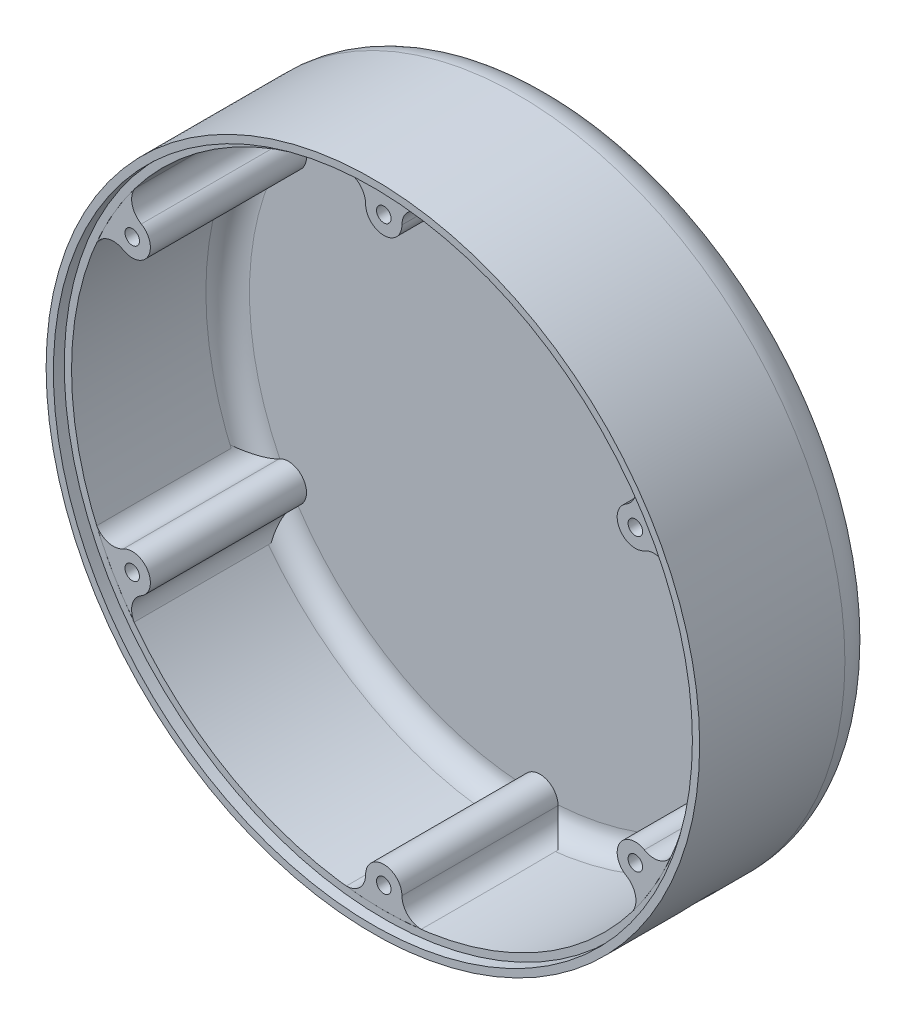
from build123d import *

# Parameters (mm, degrees)
SKETCH1_R           = 90
BOSS_EXTRUDE1_DEPTH = 50
FILLET1_R           = 10
SHELL1_T            = -4
BOSS_EXTRUDE2_START = -46
BOSS_EXTRUDE2_DEPTH = 46
SKETCH3_R           = 2
CUT_EXTRUDE1_DEPTH  = 20
CIRPATTERN1_COUNT   = 6
SKETCH5_R           = 88
CUT_EXTRUDE2_DEPTH  = 3
SKETCH6_R           = 5
CUT_EXTRUDE3_DEPTH  = 137.747943312


# Read off the part's stored shape, not the designer's step: Boss-Extrude2
with BuildPart() as part:
    # Sketch1 → Boss-Extrude1 (new body)
    with BuildSketch(Plane.XY):
        Circle(SKETCH1_R)
    extrude(amount=BOSS_EXTRUDE1_DEPTH)

    # Fillet1
    fillet1_edges = [part.edges().sort_by_distance(p)[0] for p in [
        (-90, 0, 0),
    ]]
    fillet(fillet1_edges, radius=FILLET1_R)

    # Shell1
    shell1_openings = [part.faces().sort_by_distance(p)[0] for p in [
        (0, 0, 50),
    ]]
    offset(amount=SHELL1_T, openings=shell1_openings, kind=Kind.INTERSECTION)

    # Boss-Extrude2 outline → Boss-Extrude2 (add)
    with BuildSketch(Plane.XY.offset(50).offset(BOSS_EXTRUDE2_START)):
        with BuildLine():
            ThreePointArc((-10.335164835, 85.335164835), (-6.562633601, 83.772531234), (-5, 80))
            ThreePointArc((-5, 80), (0, 75), (5, 80))
            ThreePointArc((5, 80), (6.804282934, 83.999607083), (10.996761978, 85.293984609))
            ThreePointArc((10.996761978, 85.293984609), (0.332080343, 85.978550607), (-10.335164835, 85.335164835))
        make_face()
    boss_extrude2 = extrude(amount=BOSS_EXTRUDE2_DEPTH)

    # Sketch3 → Cut-Extrude1 (cut)
    with BuildSketch(Plane.XY.offset(50)):
        with Locations((0, 80)):
            Circle(SKETCH3_R)
    cut_extrude1 = extrude(amount=-CUT_EXTRUDE1_DEPTH, mode=Mode.SUBTRACT)

    # CirPattern1: Boss-Extrude2, Cut-Extrude1 ×6 about axis
    cirpattern1_axis = Axis((0, 0, 0), (0, 0, 1))
    add([boss_extrude2.rotate(cirpattern1_axis, i * 360 / CIRPATTERN1_COUNT) for i in range(1, CIRPATTERN1_COUNT)])
    add([cut_extrude1.rotate(cirpattern1_axis, i * 360 / CIRPATTERN1_COUNT) for i in range(1, CIRPATTERN1_COUNT)], mode=Mode.SUBTRACT)

    # Sketch5 → Cut-Extrude2 (cut)
    with BuildSketch(Plane.XY.offset(50)):
        Circle(SKETCH5_R)
    extrude(amount=-CUT_EXTRUDE2_DEPTH, mode=Mode.SUBTRACT)

    # Sketch6 → Cut-Extrude3 (cut, through all)
    with BuildSketch(Plane(origin=(0, 0, 0), x_dir=(0.7071067811865477, 0.7071067811865475, 0), z_dir=(-0.7071067811865475, 0.7071067811865477, 0))):
        with Locations(Location((0, -25, 0), (0, 0, 180))):
            Circle(SKETCH6_R)
    extrude(amount=-CUT_EXTRUDE3_DEPTH, mode=Mode.SUBTRACT)


solid = part.part
